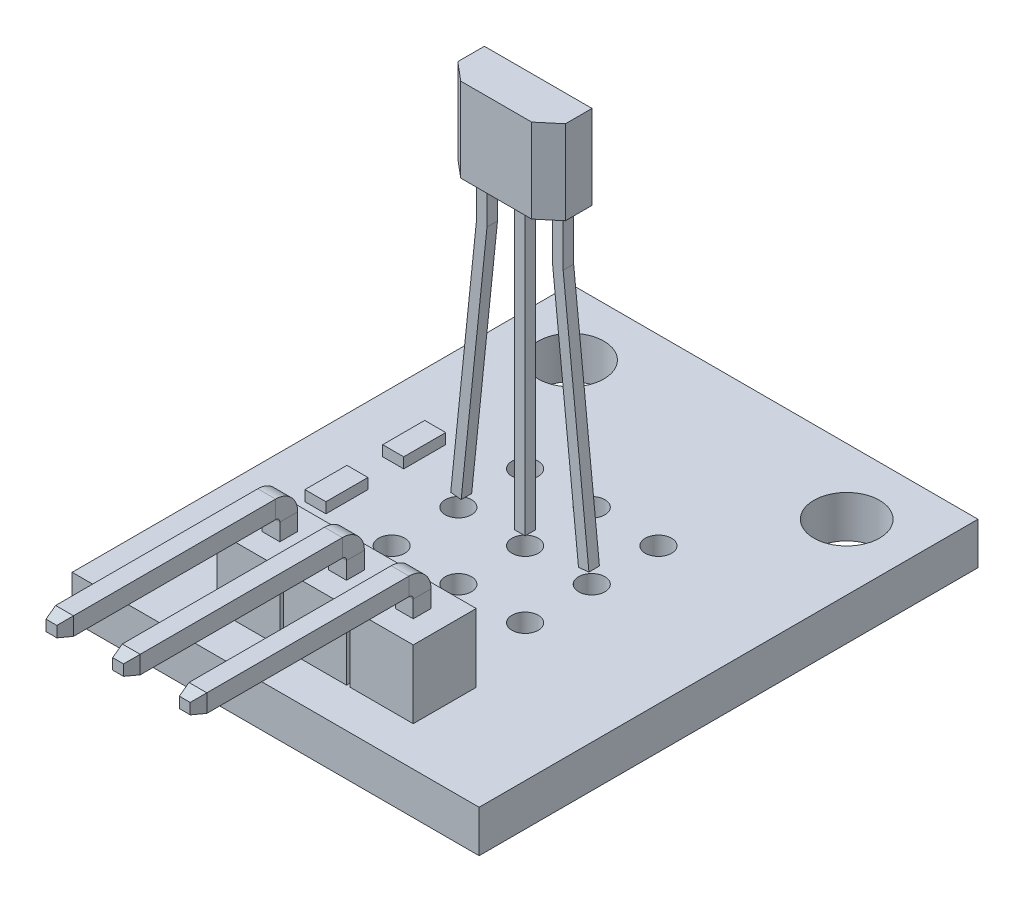
from build123d import *
from OCP.BRepFilletAPI import BRepFilletAPI_MakeChamfer

# Parameters (mm, degrees)
SKETCH1_W             = 15.5
SKETCH1_H             = 19
BOSS_EXTRUDE1_DEPTH   = 1.6
SKETCH2_W             = 2.4
SKETCH2_H             = 2.4
BOSS_EXTRUDE2_DEPTH   = 2.6
SKETCH4_W             = 0.68
SKETCH4_H             = 0.68
SKETCH8_R             = 0.5
CUT_EXTRUDE2_DEPTH    = 18.80563394
CHAMFER1_SIZE         = 0.5
CHAMFER1_SIZE2        = 0.133974596
SKETCH5_R             = 1.25
CUT_EXTRUDE1_DEPTH    = 18.80563394
SKETCH6_W             = 4.1
SKETCH6_H             = 1.6
BOSS_EXTRUDE3_DEPTH   = 3.2
CHAMFER2_SIZE         = 0.7
CHAMFER2_SIZE2        = 0.587369742
BOSS_EXTRUDE4_START   = -0.3
SKETCH7_W             = 0.4
SKETCH7_H             = 11.973992441
BOSS_EXTRUDE4_DEPTH   = 0.4
SKETCH13_W            = 0.8
SKETCH13_H            = 1.6
BOSS_EXTRUDE5_DEPTH   = 0.4
BODY_MOVE_COPY1_ANGLE = 90


with BuildPart() as part:
    # Sketch1 → Boss-Extrude1 (new body)
    with BuildSketch(Plane(origin=(0, 0, 0), x_dir=(1, 0, 0), z_dir=(0, 1, 0))):
        Rectangle(SKETCH1_W, SKETCH1_H)
    extrude(amount=BOSS_EXTRUDE1_DEPTH)

    # Sketch2 → Boss-Extrude2 (add)
    with BuildSketch(Plane(origin=(0, 1.6, 0), x_dir=(1, 0, 0), z_dir=(0, 1, 0))):
        with Locations((0, -6.8)):
            Rectangle(SKETCH2_W, SKETCH2_H)
        with Locations((-2.54, -6.8)):
            Rectangle(SKETCH2_W, SKETCH2_H)
        with Locations((2.54, -6.8)):
            Rectangle(SKETCH2_W, SKETCH2_H)
    extrude(amount=BOSS_EXTRUDE2_DEPTH)

    # Sweep1: sweep along a path in Sketch3
    with BuildLine(Plane(origin=(0, 0, 0), x_dir=(0, 0, -1), z_dir=(1, 0, 0))) as sweep1_path:
        Line((-15.5, 5.35), (-7.3, 5.35))
        ThreePointArc((-7.3, 5.35), (-6.946446609, 5.203553391), (-6.8, 4.85))
        Line((-6.8, 4.85), (-6.8, -1))
    # Sketch4 → Sweep1 (sweep)
    with BuildSketch(Plane(origin=(0, 0, 15.5), x_dir=(-1, 0, 0), z_dir=(0, 0, -1))):
        with Locations((0, 5.35)):
            Rectangle(SKETCH4_W, SKETCH4_H)
        with Locations((2.54, 5.35)):
            Rectangle(SKETCH4_W, SKETCH4_H)
        with Locations((-2.54, 5.35)):
            Rectangle(SKETCH4_W, SKETCH4_H)
    sweep(path=sweep1_path.line)

    # Sketch8 → Cut-Extrude2 (cut, through all)
    with BuildSketch(Plane(origin=(0, 1.6, 0), x_dir=(1, 0, 0), z_dir=(0, 1, 0))):
        with Locations(Location((-2.54, 2.54, 0), (0, 0, 270))):
            Circle(SKETCH8_R)
        with Locations(Location((0, 2.54, 0), (0, 0, 270))):
            Circle(SKETCH8_R)
        with Locations(Location((2.54, 2.54, 0), (0, 0, 270))):
            Circle(SKETCH8_R)
        with Locations(Location((0, 0, 0), (0, 0, 270))):
            Circle(SKETCH8_R)
        with Locations(Location((2.54, 0, 0), (0, 0, 270))):
            Circle(SKETCH8_R)
        with Locations(Location((0, -2.54, 0), (0, 0, 270))):
            Circle(SKETCH8_R)
        with Locations(Location((2.54, -2.54, 0), (0, 0, 270))):
            Circle(SKETCH8_R)
        with Locations(Location((-2.54, 0, 0), (0, 0, 270))):
            Circle(SKETCH8_R)
        with Locations(Location((-2.54, -2.54, 0), (0, 0, 270))):
            Circle(SKETCH8_R)
    extrude(amount=-CUT_EXTRUDE2_DEPTH, mode=Mode.SUBTRACT)

    # Chamfer1: one chamfer whose edges measure the first distance from different faces: ONE call of the kernel's chamfer builder (chamfer() names one face for all edges)
    chamfer1_edges_1 = [part.edges().sort_by_distance(p)[0] for p in [
        (2.2, -1, 6.8),
    ]]
    chamfer1_side_1 = [part.faces().sort_by_distance(p)[0] for p in [
        (2.2, -0.5, 6.8),
    ]]
    chamfer1_edges_2 = [part.edges().sort_by_distance(p)[0] for p in [
        (2.54, -1, 6.46),
    ]]
    chamfer1_side_2 = [part.faces().sort_by_distance(p)[0] for p in [
        (2.54, -0.5, 6.46),
    ]]
    chamfer1_edges_3 = [part.edges().sort_by_distance(p)[0] for p in [
        (2.88, -1, 6.8),
    ]]
    chamfer1_side_3 = [part.faces().sort_by_distance(p)[0] for p in [
        (2.88, -0.5, 6.8),
    ]]
    chamfer1_edges_4 = [part.edges().sort_by_distance(p)[0] for p in [
        (2.54, -1, 7.14),
    ]]
    chamfer1_side_4 = [part.faces().sort_by_distance(p)[0] for p in [
        (2.54, -0.5, 7.14),
    ]]
    chamfer1_edges_5 = [part.edges().sort_by_distance(p)[0] for p in [
        (2.88, 5.35, 15.5),
    ]]
    chamfer1_side_5 = [part.faces().sort_by_distance(p)[0] for p in [
        (2.88, 5.283535103, 10.725542578),
    ]]
    chamfer1_edges_6 = [part.edges().sort_by_distance(p)[0] for p in [
        (2.54, 5.01, 15.5),
    ]]
    chamfer1_side_6 = [part.faces().sort_by_distance(p)[0] for p in [
        (2.54, 5.01, 11.4),
    ]]
    chamfer1_edges_7 = [part.edges().sort_by_distance(p)[0] for p in [
        (2.2, 5.35, 15.5),
    ]]
    chamfer1_side_7 = [part.faces().sort_by_distance(p)[0] for p in [
        (2.2, 5.283535103, 10.725542578),
    ]]
    chamfer1_edges_8 = [part.edges().sort_by_distance(p)[0] for p in [
        (2.54, 5.69, 15.5),
    ]]
    chamfer1_side_8 = [part.faces().sort_by_distance(p)[0] for p in [
        (2.54, 5.69, 11.4),
    ]]
    chamfer1_edges_9 = [part.edges().sort_by_distance(p)[0] for p in [
        (-2.88, -1, 6.8),
    ]]
    chamfer1_side_9 = [part.faces().sort_by_distance(p)[0] for p in [
        (-2.88, -0.5, 6.8),
    ]]
    chamfer1_edges_10 = [part.edges().sort_by_distance(p)[0] for p in [
        (-2.54, -1, 6.46),
    ]]
    chamfer1_side_10 = [part.faces().sort_by_distance(p)[0] for p in [
        (-2.54, -0.5, 6.46),
    ]]
    chamfer1_edges_11 = [part.edges().sort_by_distance(p)[0] for p in [
        (-2.2, -1, 6.8),
    ]]
    chamfer1_side_11 = [part.faces().sort_by_distance(p)[0] for p in [
        (-2.2, -0.5, 6.8),
    ]]
    chamfer1_edges_12 = [part.edges().sort_by_distance(p)[0] for p in [
        (-2.54, -1, 7.14),
    ]]
    chamfer1_side_12 = [part.faces().sort_by_distance(p)[0] for p in [
        (-2.54, -0.5, 7.14),
    ]]
    chamfer1_edges_13 = [part.edges().sort_by_distance(p)[0] for p in [
        (-2.2, 5.35, 15.5),
    ]]
    chamfer1_side_13 = [part.faces().sort_by_distance(p)[0] for p in [
        (-2.2, 5.283535103, 10.725542578),
    ]]
    chamfer1_edges_14 = [part.edges().sort_by_distance(p)[0] for p in [
        (-2.54, 5.01, 15.5),
    ]]
    chamfer1_side_14 = [part.faces().sort_by_distance(p)[0] for p in [
        (-2.54, 5.01, 11.4),
    ]]
    chamfer1_edges_15 = [part.edges().sort_by_distance(p)[0] for p in [
        (-2.88, 5.35, 15.5),
    ]]
    chamfer1_side_15 = [part.faces().sort_by_distance(p)[0] for p in [
        (-2.88, 5.283535103, 10.725542578),
    ]]
    chamfer1_edges_16 = [part.edges().sort_by_distance(p)[0] for p in [
        (-2.54, 5.69, 15.5),
    ]]
    chamfer1_side_16 = [part.faces().sort_by_distance(p)[0] for p in [
        (-2.54, 5.69, 11.4),
    ]]
    chamfer1_edges_17 = [part.edges().sort_by_distance(p)[0] for p in [
        (-0.34, -1, 6.8),
    ]]
    chamfer1_side_17 = [part.faces().sort_by_distance(p)[0] for p in [
        (-0.34, -0.5, 6.8),
    ]]
    chamfer1_edges_18 = [part.edges().sort_by_distance(p)[0] for p in [
        (0, -1, 6.46),
    ]]
    chamfer1_side_18 = [part.faces().sort_by_distance(p)[0] for p in [
        (0, -0.5, 6.46),
    ]]
    chamfer1_edges_19 = [part.edges().sort_by_distance(p)[0] for p in [
        (0.34, -1, 6.8),
    ]]
    chamfer1_side_19 = [part.faces().sort_by_distance(p)[0] for p in [
        (0.34, -0.5, 6.8),
    ]]
    chamfer1_edges_20 = [part.edges().sort_by_distance(p)[0] for p in [
        (0, -1, 7.14),
    ]]
    chamfer1_side_20 = [part.faces().sort_by_distance(p)[0] for p in [
        (0, -0.5, 7.14),
    ]]
    chamfer1_edges_21 = [part.edges().sort_by_distance(p)[0] for p in [
        (0.34, 5.35, 15.5),
    ]]
    chamfer1_side_21 = [part.faces().sort_by_distance(p)[0] for p in [
        (0.34, 5.283535103, 10.725542578),
    ]]
    chamfer1_edges_22 = [part.edges().sort_by_distance(p)[0] for p in [
        (0, 5.01, 15.5),
    ]]
    chamfer1_side_22 = [part.faces().sort_by_distance(p)[0] for p in [
        (0, 5.01, 11.4),
    ]]
    chamfer1_edges_23 = [part.edges().sort_by_distance(p)[0] for p in [
        (-0.34, 5.35, 15.5),
    ]]
    chamfer1_side_23 = [part.faces().sort_by_distance(p)[0] for p in [
        (-0.34, 5.283535103, 10.725542578),
    ]]
    chamfer1_edges_24 = [part.edges().sort_by_distance(p)[0] for p in [
        (0, 5.69, 15.5),
    ]]
    chamfer1_side_24 = [part.faces().sort_by_distance(p)[0] for p in [
        (0, 5.69, 11.4),
    ]]
    chamfer1 = BRepFilletAPI_MakeChamfer(part.part.solid().wrapped)
    for e in chamfer1_edges_1:
        chamfer1.Add(CHAMFER1_SIZE, CHAMFER1_SIZE2, e.wrapped, chamfer1_side_1[0].wrapped)  # the first distance lies on this face
    for e in chamfer1_edges_2:
        chamfer1.Add(CHAMFER1_SIZE, CHAMFER1_SIZE2, e.wrapped, chamfer1_side_2[0].wrapped)  # the first distance lies on this face
    for e in chamfer1_edges_3:
        chamfer1.Add(CHAMFER1_SIZE, CHAMFER1_SIZE2, e.wrapped, chamfer1_side_3[0].wrapped)  # the first distance lies on this face
    for e in chamfer1_edges_4:
        chamfer1.Add(CHAMFER1_SIZE, CHAMFER1_SIZE2, e.wrapped, chamfer1_side_4[0].wrapped)  # the first distance lies on this face
    for e in chamfer1_edges_5:
        chamfer1.Add(CHAMFER1_SIZE, CHAMFER1_SIZE2, e.wrapped, chamfer1_side_5[0].wrapped)  # the first distance lies on this face
    for e in chamfer1_edges_6:
        chamfer1.Add(CHAMFER1_SIZE, CHAMFER1_SIZE2, e.wrapped, chamfer1_side_6[0].wrapped)  # the first distance lies on this face
    for e in chamfer1_edges_7:
        chamfer1.Add(CHAMFER1_SIZE, CHAMFER1_SIZE2, e.wrapped, chamfer1_side_7[0].wrapped)  # the first distance lies on this face
    for e in chamfer1_edges_8:
        chamfer1.Add(CHAMFER1_SIZE, CHAMFER1_SIZE2, e.wrapped, chamfer1_side_8[0].wrapped)  # the first distance lies on this face
    for e in chamfer1_edges_9:
        chamfer1.Add(CHAMFER1_SIZE, CHAMFER1_SIZE2, e.wrapped, chamfer1_side_9[0].wrapped)  # the first distance lies on this face
    for e in chamfer1_edges_10:
        chamfer1.Add(CHAMFER1_SIZE, CHAMFER1_SIZE2, e.wrapped, chamfer1_side_10[0].wrapped)  # the first distance lies on this face
    for e in chamfer1_edges_11:
        chamfer1.Add(CHAMFER1_SIZE, CHAMFER1_SIZE2, e.wrapped, chamfer1_side_11[0].wrapped)  # the first distance lies on this face
    for e in chamfer1_edges_12:
        chamfer1.Add(CHAMFER1_SIZE, CHAMFER1_SIZE2, e.wrapped, chamfer1_side_12[0].wrapped)  # the first distance lies on this face
    for e in chamfer1_edges_13:
        chamfer1.Add(CHAMFER1_SIZE, CHAMFER1_SIZE2, e.wrapped, chamfer1_side_13[0].wrapped)  # the first distance lies on this face
    for e in chamfer1_edges_14:
        chamfer1.Add(CHAMFER1_SIZE, CHAMFER1_SIZE2, e.wrapped, chamfer1_side_14[0].wrapped)  # the first distance lies on this face
    for e in chamfer1_edges_15:
        chamfer1.Add(CHAMFER1_SIZE, CHAMFER1_SIZE2, e.wrapped, chamfer1_side_15[0].wrapped)  # the first distance lies on this face
    for e in chamfer1_edges_16:
        chamfer1.Add(CHAMFER1_SIZE, CHAMFER1_SIZE2, e.wrapped, chamfer1_side_16[0].wrapped)  # the first distance lies on this face
    for e in chamfer1_edges_17:
        chamfer1.Add(CHAMFER1_SIZE, CHAMFER1_SIZE2, e.wrapped, chamfer1_side_17[0].wrapped)  # the first distance lies on this face
    for e in chamfer1_edges_18:
        chamfer1.Add(CHAMFER1_SIZE, CHAMFER1_SIZE2, e.wrapped, chamfer1_side_18[0].wrapped)  # the first distance lies on this face
    for e in chamfer1_edges_19:
        chamfer1.Add(CHAMFER1_SIZE, CHAMFER1_SIZE2, e.wrapped, chamfer1_side_19[0].wrapped)  # the first distance lies on this face
    for e in chamfer1_edges_20:
        chamfer1.Add(CHAMFER1_SIZE, CHAMFER1_SIZE2, e.wrapped, chamfer1_side_20[0].wrapped)  # the first distance lies on this face
    for e in chamfer1_edges_21:
        chamfer1.Add(CHAMFER1_SIZE, CHAMFER1_SIZE2, e.wrapped, chamfer1_side_21[0].wrapped)  # the first distance lies on this face
    for e in chamfer1_edges_22:
        chamfer1.Add(CHAMFER1_SIZE, CHAMFER1_SIZE2, e.wrapped, chamfer1_side_22[0].wrapped)  # the first distance lies on this face
    for e in chamfer1_edges_23:
        chamfer1.Add(CHAMFER1_SIZE, CHAMFER1_SIZE2, e.wrapped, chamfer1_side_23[0].wrapped)  # the first distance lies on this face
    for e in chamfer1_edges_24:
        chamfer1.Add(CHAMFER1_SIZE, CHAMFER1_SIZE2, e.wrapped, chamfer1_side_24[0].wrapped)  # the first distance lies on this face
    add(Compound.cast(chamfer1.Shape()), mode=Mode.REPLACE)

    # Sketch5 → Cut-Extrude1 (cut, through all)
    with BuildSketch(Plane(origin=(0, 1.6, 0), x_dir=(1, 0, 0), z_dir=(0, 1, 0))):
        with Locations(Location((-5.25, 7, 0), (0, 0, 270))):
            Circle(SKETCH5_R)
        with Locations(Location((5.25, 7, 0), (0, 0, 270))):
            Circle(SKETCH5_R)
    extrude(amount=-CUT_EXTRUDE1_DEPTH, mode=Mode.SUBTRACT)

    # Sketch13 → Boss-Extrude5 (add)
    with BuildSketch(Plane(origin=(0, 1.6, 0), x_dir=(1, 0, 0), z_dir=(0, 1, 0))):
        with Locations((-5.245052358, 1.022726005)):
            Rectangle(SKETCH13_W, SKETCH13_H)
        with Locations((-5.245052358, -1.940051544)):
            Rectangle(SKETCH13_W, SKETCH13_H)
    extrude(amount=BOSS_EXTRUDE5_DEPTH)


with BuildPart() as body_2:
    # Sketch6 → Boss-Extrude3 (new body)
    with BuildSketch(Plane(origin=(0, 0, -12.5), x_dir=(-1, 0, 0), z_dir=(0, 0, -1))):
        with Locations((0, 2.8)):
            Rectangle(SKETCH6_W, SKETCH6_H)
    extrude(amount=BOSS_EXTRUDE3_DEPTH)

    # Chamfer2
    chamfer2_edges = [body_2.edges().sort_by_distance(p)[0] for p in [
        (2.05, 3.6, -14.1),
        (-2.05, 3.6, -14.1),
    ]]
    chamfer2_side = [body_2.faces().sort_by_distance(p)[0] for p in [
        (0, 3.6, -14.1),
    ]]
    chamfer(chamfer2_edges, length=CHAMFER2_SIZE, length2=CHAMFER2_SIZE2, reference=chamfer2_side[0])

    # Sketch7 → Boss-Extrude4 (add)
    with BuildSketch(Plane.XZ.offset(-2).offset(BOSS_EXTRUDE4_START)):
        Polygon((1.65, -12.5), (1.65, -10.510353135), (2.632421634, -1.046658491), (2.234559653, -1.005356628), (1.25, -10.489646865), (1.25, -12.5), align=None)
        with Locations((0, -7.013003779)):
            Rectangle(SKETCH7_W, SKETCH7_H)
        Polygon((-1.25, -12.5), (-1.25, -10.489646865), (-2.234559653, -1.005356628), (-2.632421634, -1.046658491), (-1.65, -10.510353135), (-1.65, -12.5), align=None)
    extrude(amount=-BOSS_EXTRUDE4_DEPTH)


with BuildPart() as body_2_1:
    # Body-Move/Copy1: read off the stored shape, not the designer's step
    # Body-Move/Copy1: moved
    add(body_2.part.moved(Location((0, -0.5, -1.1))).rotate(Axis((0, 0, 0), (1, 0, 0)), BODY_MOVE_COPY1_ANGLE))


with BuildPart() as body_2_2:
    # Body-Move/Copy2: moved
    add(body_2_1.part.moved(Location((0, 0, -2))))


solid = Compound([part.part, body_2_2.part])
